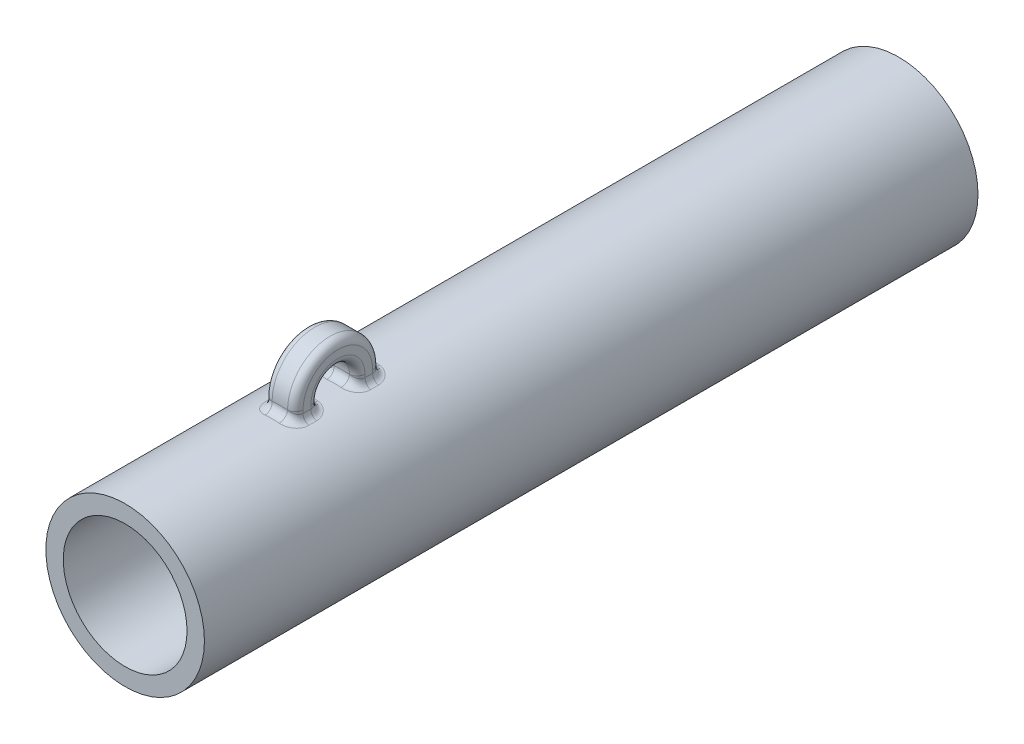
from build123d import *

# Parameters (mm, degrees)
SKETCH1_R                = 10.25
SKETCH1_R_2              = 8
BOSS_EXTRUDE1_DEPTH      = 100
BOSS_EXTRUDE2_DEPTH      = 2
BOSS_EXTRUDE2_DEPTH_BACK = 2
FILLET1_R                = 1


with BuildPart() as part:
    # Sketch1 → Boss-Extrude1 (new body)
    with BuildSketch(Plane.XY):
        Circle(SKETCH1_R)
        Circle(SKETCH1_R_2, mode=Mode.SUBTRACT)
    extrude(amount=BOSS_EXTRUDE1_DEPTH)

    # Sketch3 → Boss-Extrude2 (add, two sides: drawn at the far end of the back side and taken through both)
    with BuildSketch(Plane(origin=(0, 0, 0), x_dir=(0, 0, -1), z_dir=(1, 0, 0)).offset(-BOSS_EXTRUDE2_DEPTH_BACK)):
        with BuildLine():
            Line((-80, 11.25), (-80, 8.25))
            Line((-80, 8.25), (-77, 8.25))
            Line((-77, 8.25), (-77, 11.25))
            ThreePointArc((-77, 11.25), (-74.5, 13.75), (-72, 11.25))
            Line((-72, 11.25), (-72, 8.25))
            Line((-72, 8.25), (-69, 8.25))
            Line((-69, 8.25), (-69, 11.25))
            ThreePointArc((-69, 11.25), (-74.5, 16.75), (-80, 11.25))
        make_face()
    extrude(amount=BOSS_EXTRUDE2_DEPTH + BOSS_EXTRUDE2_DEPTH_BACK)

    # Fillet1
    fillet1_edges = [part.edges().sort_by_distance(p)[0] for p in [
        (0, 10.25, 72),
        (0, 10.25, 69),
        (-2, 10.052984631, 70.5),
        (2, 10.052984631, 78.5),
        (0, 10.25, 80),
        (0, 10.25, 77),
        (-2, 10.052984631, 78.5),
        (2, 10.651492316, 80),
        (2, 10.651492316, 77),
        (2, 13.75, 74.5),
        (2, 10.651492316, 72),
        (2, 10.651492316, 69),
        (2, 16.75, 74.5),
        (-2, 10.651492316, 77),
        (-2, 10.651492316, 80),
        (-2, 16.75, 74.5),
        (-2, 10.651492316, 69),
        (-2, 10.651492316, 72),
        (-2, 13.75, 74.5),
        (2, 10.052984631, 70.5),
    ]]
    fillet(fillet1_edges, radius=FILLET1_R - 0.0001)  # a hair under: the kernel refuses the full size


solid = part.part
